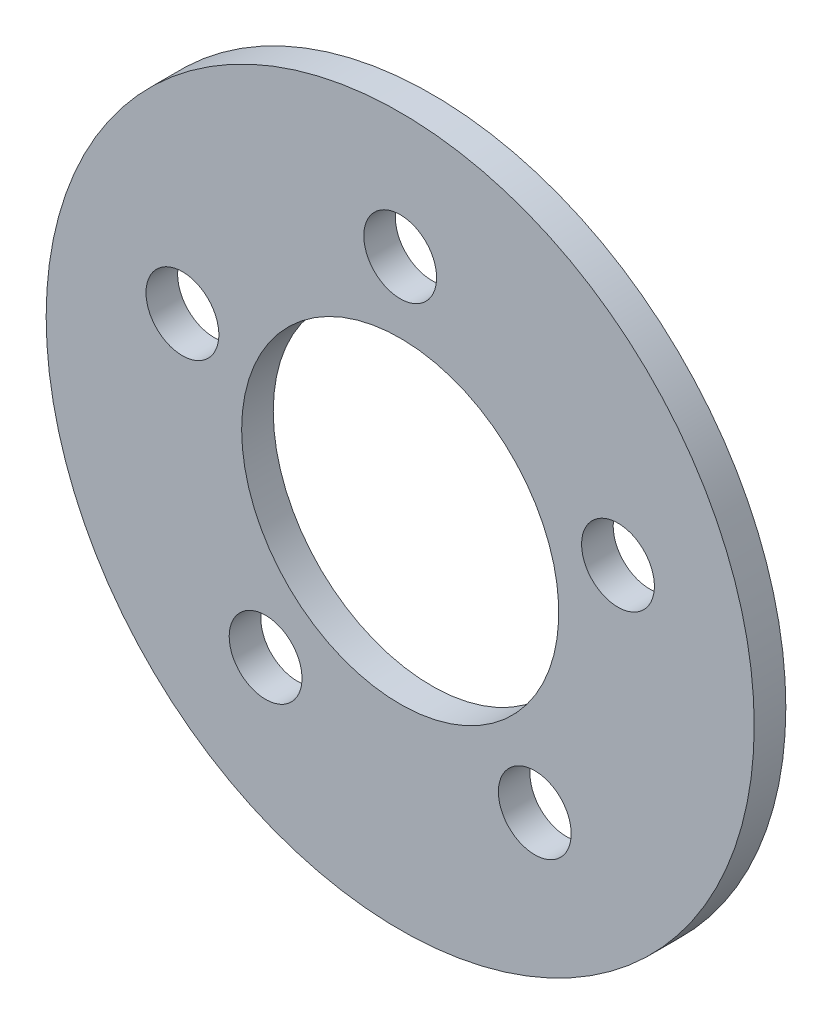
from build123d import *

# Parameters (mm, degrees)
SKETCH3_R           = 17.78
SKETCH3_R_2         = 7.9629
SKETCH3_R_3         = 1.8288
BOSS_EXTRUDE2_DEPTH = 1.5875


with BuildPart() as part:
    # Sketch3 → Boss-Extrude2 (new body)
    with BuildSketch(Plane(origin=(0, 0, -12.7), x_dir=(-1, 0, 0), z_dir=(0, 0, -1))):
        Circle(SKETCH3_R)
        Circle(SKETCH3_R_2, mode=Mode.SUBTRACT)
        with Locations((-6.759530401, -9.303695435)):
            Circle(SKETCH3_R_3, mode=Mode.SUBTRACT)
        with Locations((6.759530401, -9.303695435)):
            Circle(SKETCH3_R_3, mode=Mode.SUBTRACT)
        with Locations((10.937149937, 3.553695435)):
            Circle(SKETCH3_R_3, mode=Mode.SUBTRACT)
        with Locations((0, 11.5)):
            Circle(SKETCH3_R_3, mode=Mode.SUBTRACT)
        with Locations((-10.937149937, 3.553695435)):
            Circle(SKETCH3_R_3, mode=Mode.SUBTRACT)
    extrude(amount=BOSS_EXTRUDE2_DEPTH)


solid = part.part
